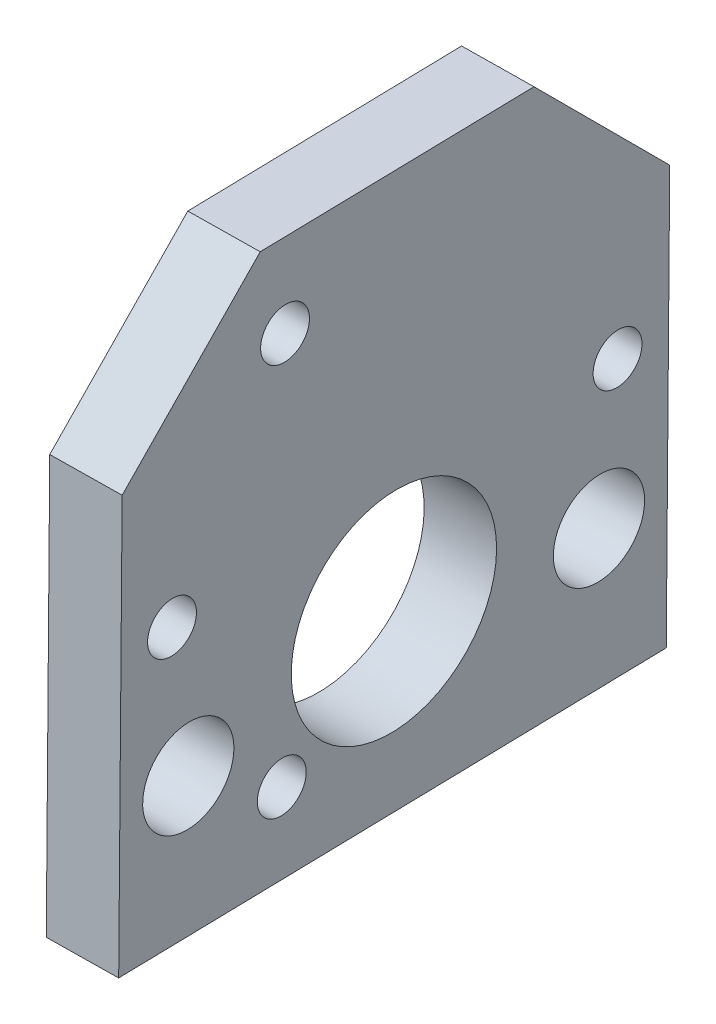
from build123d import *

# Parameters (mm, degrees)
SKETCH1_W                  = 38.1
SKETCH1_H                  = 38.1
SKETCH1_R                  = 7.14375
BOSS_EXTRUDE1_DEPTH        = 4.826
CHAMFER1_SIZE              = 9.525
M3_CLEARANCE_HOLE1_D       = 3.4
F_1_4_0_2500_DOWEL_HOLE1_D = 6.35


with BuildPart() as part:
    # Sketch1 → Boss-Extrude1 (new body)
    with BuildSketch(Plane(origin=(39.529642419, -0.323730785, -0.851619523), x_dir=(-0.021538100750096618, 8.818218568853461e-05, -0.9997680243136309), z_dir=(0.9997345031373621, -0.008187395970047001, -0.021538100750096614))):
        Rectangle(SKETCH1_W, SKETCH1_H)
        with Locations((0, -7.112)):
            Circle(SKETCH1_R, mode=Mode.SUBTRACT)
    extrude(amount=BOSS_EXTRUDE1_DEPTH)

    # Chamfer1
    chamfer1_edges = [part.edges().sort_by_distance(p)[0] for p in [
        (41.687670849, 18.707554321, -19.950851694),
        (42.508272488, 18.70419458, 18.140310032),
    ]]
    chamfer(chamfer1_edges, length=CHAMFER1_SIZE)

    # M3 Clearance Hole1 (through all)
    with Locations(Plane(origin=(44.354361132, -0.363243158, -0.955562398), x_dir=(-0.02153810075009662, 8.818218568853714e-05, -0.9997680243136309), z_dir=(0.9997345031373621, -0.008187395970047003, -0.021538100750096618))):
        with Locations((15.5, -0.112), (-15.5, -0.112), (-7.75, -13.535393759), (-7.75, 13.311393759)):
            Hole(M3_CLEARANCE_HOLE1_D / 2)

    # 1/4 (0.2500) Dowel Hole1 (through all)
    with Locations(Plane(origin=(44.354361132, -0.363243158, -0.955562398), x_dir=(-0.02153737851632655, 0.00017638187490436234, -0.9997680282025819), z_dir=(0.9997345031373622, -0.008187395970047012, -0.021538100750096777))):
        with Locations((14.286872703, -9.526260177), (-14.288127297, -9.526260177)):
            Hole(F_1_4_0_2500_DOWEL_HOLE1_D / 2)


solid = part.part
